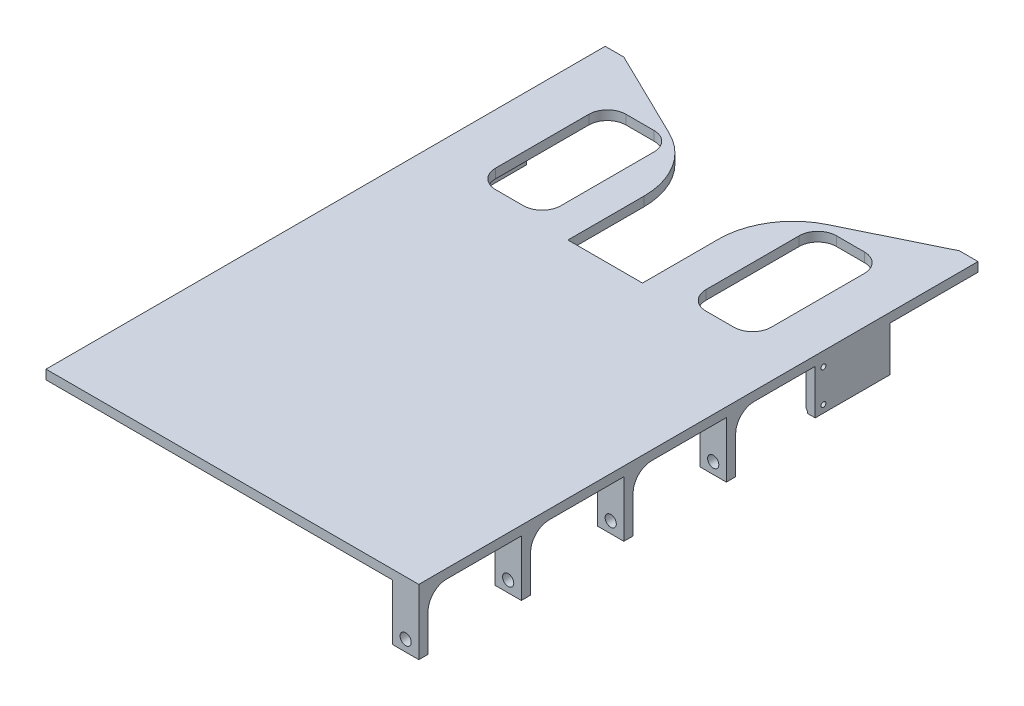
from build123d import *

# Parameters (mm, degrees)
BOSS_EXTRUDE1_DEPTH = 5
SKETCH2_W           = 5
SKETCH2_H           = 40
BOSS_EXTRUDE2_DEPTH = 24
SKETCH3_R           = 1.3
CUT_EXTRUDE2_DEPTH  = 362.353012994
CUT_EXTRUDE3_REACH  = 363.72
SKETCH4_W           = 35
SKETCH4_H           = 70
FILLET1_R           = 10
FILLET2_R           = 40
SKETCH5_W           = 14.100331178
SKETCH5_H           = 5
BOSS_EXTRUDE3_DEPTH = 30
FILLET3_R           = 10
SKETCH6_R           = 3
CUT_EXTRUDE4_DEPTH  = 362.801050303


with BuildPart() as part:
    # Sketch1 → Boss-Extrude1 (new body)
    with BuildSketch(Plane(origin=(0, 0, 0), x_dir=(1, 0, 0), z_dir=(0, 1, 0))):
        Polygon((0, 0), (0, -300), (200, -300), (200, 0), (190, 0), (120, -34.158147671), (120, -100), (80, -100), (80, -34.158147671), (10, 0), align=None)
    extrude(amount=BOSS_EXTRUDE1_DEPTH)

    # Sketch2 → Boss-Extrude2 (add)
    with BuildSketch(Plane.XZ):
        with Locations((2.5, 67.320933646)):
            Rectangle(SKETCH2_W, SKETCH2_H)
        with Locations((197.5, 67.320933646)):
            Rectangle(SKETCH2_W, SKETCH2_H)
    extrude(amount=BOSS_EXTRUDE2_DEPTH)

    # Sketch3 → Cut-Extrude2 (cut, through all)
    with BuildSketch(Plane(origin=(200, 0, 0), x_dir=(0, 0, -1), z_dir=(1, 0, 0))):
        with Locations((-82.9, -2.5)):
            Circle(SKETCH3_R)
        with Locations((-82.9, -20)):
            Circle(SKETCH3_R)
    extrude(amount=-CUT_EXTRUDE2_DEPTH, mode=Mode.SUBTRACT)

    # Sketch4 → Cut-Extrude3 (cut, up to next)
    with BuildSketch(Plane(origin=(0, 5, 0), x_dir=(1, 0, 0), z_dir=(0, 1, 0)), mode=Mode.PRIVATE) as cut_extrude3_sk1:
        with Locations((157.554129327, -61)):
            Rectangle(SKETCH4_W, SKETCH4_H)
    cut_extrude3_tool1 = extrude(cut_extrude3_sk1.sketch, amount=-CUT_EXTRUDE3_REACH, mode=Mode.PRIVATE) & part.part
    # Sketch4 → Cut-Extrude3 (cut, up to next)
    with BuildSketch(Plane(origin=(0, 5, 0), x_dir=(1, 0, 0), z_dir=(0, 1, 0)), mode=Mode.PRIVATE) as cut_extrude3_sk2:
        with Locations((44.67599733, -61)):
            Rectangle(SKETCH4_W, SKETCH4_H)
    cut_extrude3_tool2 = extrude(cut_extrude3_sk2.sketch, amount=-CUT_EXTRUDE3_REACH, mode=Mode.PRIVATE) & part.part
    add(cut_extrude3_tool1.solids().sort_by_distance((157.554129, 5, 61))[0], mode=Mode.SUBTRACT)
    add(cut_extrude3_tool2.solids().sort_by_distance((44.675997, 5, 61))[0], mode=Mode.SUBTRACT)

    # Fillet1
    fillet1_edges = [part.edges().sort_by_distance(p)[0] for p in [
        (27.17599733, 2.5, 26),
        (27.17599733, 2.5, 96),
        (62.17599733, 2.5, 96),
        (62.17599733, 2.5, 26),
        (140.054129327, 2.5, 96),
        (175.054129327, 2.5, 96),
        (175.054129327, 2.5, 26),
        (140.054129327, 2.5, 26),
    ]]
    fillet(fillet1_edges, radius=FILLET1_R)

    # Fillet2
    fillet2_edges = [part.edges().sort_by_distance(p)[0] for p in [
        (120, 2.5, 34.158147671),
        (80, 2.5, 34.158147671),
    ]]
    fillet(fillet2_edges, radius=FILLET2_R)

    # Sketch5 → Boss-Extrude3 (add)
    with BuildSketch(Plane.XZ):
        with Locations((192.949834411, 297.5)):
            Rectangle(SKETCH5_W, SKETCH5_H)
        with Locations((192.949834411, 242.5)):
            Rectangle(SKETCH5_W, SKETCH5_H)
        with Locations((192.949834411, 187.5)):
            Rectangle(SKETCH5_W, SKETCH5_H)
        with Locations((192.949834411, 132.5)):
            Rectangle(SKETCH5_W, SKETCH5_H)
    extrude(amount=BOSS_EXTRUDE3_DEPTH)

    # Fillet3
    fillet3_edges = [part.edges().sort_by_distance(p)[0] for p in [
        (192.949834411, 0, 130),
        (192.949834411, 0, 185),
        (192.949834411, 0, 240),
        (192.949834411, 0, 295),
    ]]
    fillet(fillet3_edges, radius=FILLET3_R)

    # Sketch6 → Cut-Extrude4 (cut, through all)
    with BuildSketch(Plane.XY.offset(300)):
        with Locations((192.949834411, -24)):
            Circle(SKETCH6_R)
    extrude(amount=-CUT_EXTRUDE4_DEPTH, mode=Mode.SUBTRACT)


solid = part.part
